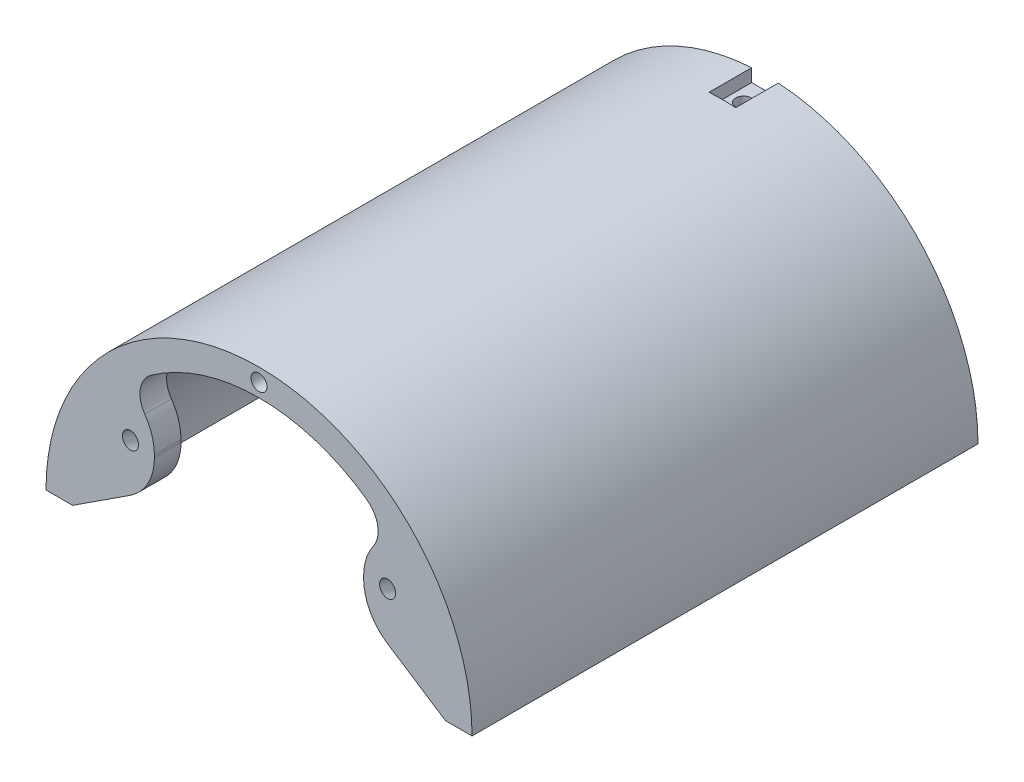
from build123d import *
from OCP.BRepFilletAPI import BRepFilletAPI_MakeChamfer

# Parameters (mm, degrees)
SALIENTE_EXTRUIR1_DEPTH = 95
VACIADO1_T              = -5
CORTAR_EXTRUIR1_DEPTH   = 2.5
CROQUIS3_R              = 1.5
CORTAR_EXTRUIR4_DEPTH   = 5
SALIENTE_EXTRUIR2_DEPTH = 5
CHAFL_N1_SIZE           = 5
CHAFL_N1_SIZE2          = 1.819851171331016
CROQUIS5_R              = 1.5000000000000009
CORTAR_EXTRUIR5_DEPTH   = 107.86778586495213
CROQUIS6_W              = 80
CROQUIS6_H              = 6.500000000000014
CORTAR_EXTRUIR6_DEPTH   = 115.89125293076057
SALIENTE_EXTRUIR3_START = -5
SALIENTE_EXTRUIR3_DEPTH = 5
REDONDEO1_R             = 10
REDONDEO2_R             = 5
CROQUIS8_R              = 1.5000000000000004
CORTAR_EXTRUIR7_DEPTH   = 5


with BuildPart() as part:
    # Croquis1 → Saliente-Extruir1 (new body)
    with BuildSketch(Plane.XY):
        with BuildLine():
            Line((-40, 0), (40, 0))
            ThreePointArc((40, 0), (2.45e-15, 40), (-40, 0))
        make_face()
    extrude(amount=SALIENTE_EXTRUIR1_DEPTH)

    # Vaciado1
    vaciado1_openings = [part.faces().sort_by_distance(p)[0] for p in [
        (0, 16.976527263, 95),
        (0, 16.976527263, 0),
        (0, 0, 47.5),
    ]]
    offset(amount=VACIADO1_T, openings=vaciado1_openings)

    # Croquis2 → Cortar-Extruir1 (cut)
    with BuildSketch(Plane(origin=(0, 40, 0), x_dir=(1, 0, 0), z_dir=(0, 1, 0))):
        Polygon((2.499999999999998, 8), (-2.500000000000002, 8), (-2.499999999999997, -8), (2.500000000000003, -8), align=None)
    extrude(amount=-CORTAR_EXTRUIR1_DEPTH, mode=Mode.SUBTRACT)

    # Croquis3 → Cortar-Extruir4 (cut)
    with BuildSketch(Plane(origin=(0, 37.5, 0), x_dir=(1, 0, 0), z_dir=(0, 1, 0))):
        with Locations(Location((3.04e-15, -4.0000000000000036, 0), (0, 0, 270))):
            Circle(CROQUIS3_R)
    extrude(amount=-CORTAR_EXTRUIR4_DEPTH, mode=Mode.SUBTRACT)

    # Croquis4 → Saliente-Extruir2 (add, symmetric)
    with BuildSketch(Plane.XY.offset(95)):
        with BuildLine():
            Line((34.64101615137755, 20), (19.641016151377546, 20))
            Line((19.641016151377546, 20), (19.641016151377542, 9.999999999999998))
            Line((19.641016151377542, 9.999999999999998), (38.72983346207417, 10))
            ThreePointArc((38.72983346207417, 10), (37.024591736438325, 15.138679161342415), (34.64101615137755, 20))
        make_face()
        with BuildLine():
            Line((-19.641016151377542, 9.999999999999998), (-38.72983346207417, 10))
            ThreePointArc((-38.72983346207417, 10), (-37.024591736438325, 15.138679161342413), (-34.64101615137755, 20))
            Line((-34.64101615137755, 20), (-19.641016151377546, 20))
            Line((-19.641016151377546, 20), (-19.641016151377542, 9.999999999999998))
        make_face()
    extrude(amount=SALIENTE_EXTRUIR2_DEPTH, both=True)

    # Chaflán1: one chamfer whose edges measure the first distance from different faces: ONE call of the kernel's chamfer builder (chamfer() names one face for all edges)
    chafl_n1_edges_1 = [part.edges().sort_by_distance(p)[0] for p in [
        (27.14101615137755, 20, 100),
    ]]
    chafl_n1_side_1 = [part.faces().sort_by_distance(p)[0] for p in [
        (28.335600223521073, 14.80398786251226, 100),
    ]]
    chafl_n1_edges_2 = [part.edges().sort_by_distance(p)[0] for p in [
        (-27.14101615137755, 20, 100),
    ]]
    chafl_n1_side_2 = [part.faces().sort_by_distance(p)[0] for p in [
        (-28.33560022352108, 14.803987862512262, 100),
    ]]
    chafl_n1 = BRepFilletAPI_MakeChamfer(part.part.solid().wrapped)
    for e in chafl_n1_edges_1:
        chafl_n1.Add(CHAFL_N1_SIZE, CHAFL_N1_SIZE2, e.wrapped, chafl_n1_side_1[0].wrapped)  # the first distance lies on this face
    for e in chafl_n1_edges_2:
        chafl_n1.Add(CHAFL_N1_SIZE, CHAFL_N1_SIZE2, e.wrapped, chafl_n1_side_2[0].wrapped)  # the first distance lies on this face
    add(Compound.cast(chafl_n1.Shape()), mode=Mode.REPLACE)

    # Croquis5 → Cortar-Extruir5 (cut, through all)
    with BuildSketch(Plane(origin=(0, 33.89404716093429, 93.12312922859813), x_dir=(1, 0, 0), z_dir=(0, 0.3420201433256652, 0.9396926207859096))):
        with Locations(Location((-24.141016151377546, -17.446180589588106, 0), (0, 0, 270))):
            Circle(CROQUIS5_R)
        with Locations(Location((24.141016151377546, -17.446180589588106, 0), (0, 0, 90))):
            Circle(CROQUIS5_R)
    extrude(amount=-CORTAR_EXTRUIR5_DEPTH, mode=Mode.SUBTRACT)

    # Croquis6 → Cortar-Extruir6 (cut, through all)
    with BuildSketch(Plane(origin=(0, 0, 0), x_dir=(1, 0, 0), z_dir=(0, 1, 0))):
        with Locations((0, -98.25)):
            Rectangle(CROQUIS6_W, CROQUIS6_H)
    extrude(amount=CORTAR_EXTRUIR6_DEPTH, mode=Mode.SUBTRACT)

    # Croquis7 → Saliente-Extruir3 (add)
    with BuildSketch(Plane.XY.offset(95).offset(SALIENTE_EXTRUIR3_START)):
        with BuildLine():
            Line((19.641016151377542, 9.999999999999998), (35, 0))
            ThreePointArc((35, 0), (34.633334290733465, 5.052935375235389), (33.54101966249685, 10))
            Line((33.54101966249685, 10), (19.641016151377542, 9.999999999999998))
        make_face()
        with BuildLine():
            Line((-19.641016151377542, 9.999999999999998), (-35, 0))
            ThreePointArc((-35, 0), (-34.63333429073347, 5.0529353752354), (-33.54101966249685, 10))
            Line((-33.54101966249685, 10), (-19.641016151377542, 9.999999999999998))
        make_face()
        with BuildLine():
            Line((-19.641016151377546, 20), (-28.722813232690147, 20))
            ThreePointArc((-28.722813232690147, 20), (-26.75936830732511, 22.559614531124524), (-24.568594519878932, 24.927578368501326))
            Line((-24.568594519878932, 24.927578368501326), (-19.641016151377546, 20))
        make_face()
        with BuildLine():
            Line((19.641016151377546, 20), (28.722813232690147, 20))
            ThreePointArc((28.722813232690147, 20), (26.75936830732511, 22.559614531124524), (24.568594519878932, 24.927578368501326))
            Line((24.568594519878932, 24.927578368501326), (19.641016151377546, 20))
        make_face()
    extrude(amount=SALIENTE_EXTRUIR3_DEPTH)

    # Redondeo1
    redondeo1_edges = [part.edges().sort_by_distance(p)[0] for p in [
        (-19.641016151377546, 20, 92.5),
        (-19.641016151377542, 9.999999999999998, 92.5),
        (19.641016151377542, 9.999999999999998, 92.5),
        (19.641016151377546, 20, 92.5),
    ]]
    fillet(redondeo1_edges, radius=REDONDEO1_R)

    # Redondeo2
    # the kernel refuses this fillet: 5 mm, written as the material it adds along each edge
    with BuildSketch(Plane(origin=(24.568594519878932, 24.927578368501326, 90), x_dir=(-0.7663954409927094, 0.6423690746180039, 0), z_dir=(0, 0, 1))) as redondeo2_piece_1:
        with BuildLine():
            CenterArc((5.230741996241704, 4.983783963286785), REDONDEO2_R, 184.9379912398929, 89.6777604033997)
            Line((0.2492997983567551, 4.553396197276695), (-0.24884442143173913, 4.510357420675686))
            ThreePointArc((-0.24884442143173913, 4.510357420675686), (-0.2501886476220602, 2.859471760516391), (-0.4980734710416599, 0.04384994235474339))
            Line((-0.4980734710416599, 0.04384994235474339), (-0.04023647689416843, -0.49837839632867914))
            ThreePointArc((-0.04023647689416843, -0.49837839632867914), (2.816553382591687, -0.6135122569925113), (5.673343242077539, -0.49837839632867886))
            Line((5.673343242077539, -0.49837839632867886), (5.633106765183373, 2.3e-16))
        make_face()
    extrude(amount=5)
    with BuildSketch(Plane(origin=(-24.568594519878932, 24.927578368501326, 90), x_dir=(0.7663954409927088, 0.6423690746180043, 0), z_dir=(0, 0, 1))) as redondeo2_piece_2:
        with BuildLine():
            CenterArc((5.2307419962416954, -4.9837839632867835), REDONDEO2_R, 85.38424835670739, 89.67776040339973)
            Line((0.24929979835674423, -4.553396197276693), (-0.24884442143174967, -4.510357420675684))
            ThreePointArc((-0.24884442143174967, -4.510357420675684), (-0.2501886476220599, -2.8594717605163877), (-0.4980734710416599, -0.04384994235474303))
            Line((-0.4980734710416599, -0.04384994235474303), (-0.0402364768941681, 0.4983783963286791))
            ThreePointArc((-0.0402364768941681, 0.4983783963286791), (2.816553382591687, 0.6135122569925143), (5.673343242077529, 0.49837839632867875))
            Line((5.673343242077529, 0.49837839632867875), (5.633106765183362, 3.7e-16))
        make_face()
    extrude(amount=5)

    # Croquis8 → Cortar-Extruir7 (cut)
    with BuildSketch(Plane.XY.offset(95)):
        with Locations((2.3e-15, 37.50000000000001)):
            Circle(CROQUIS8_R)
    extrude(amount=-CORTAR_EXTRUIR7_DEPTH, mode=Mode.SUBTRACT)


solid = part.part
